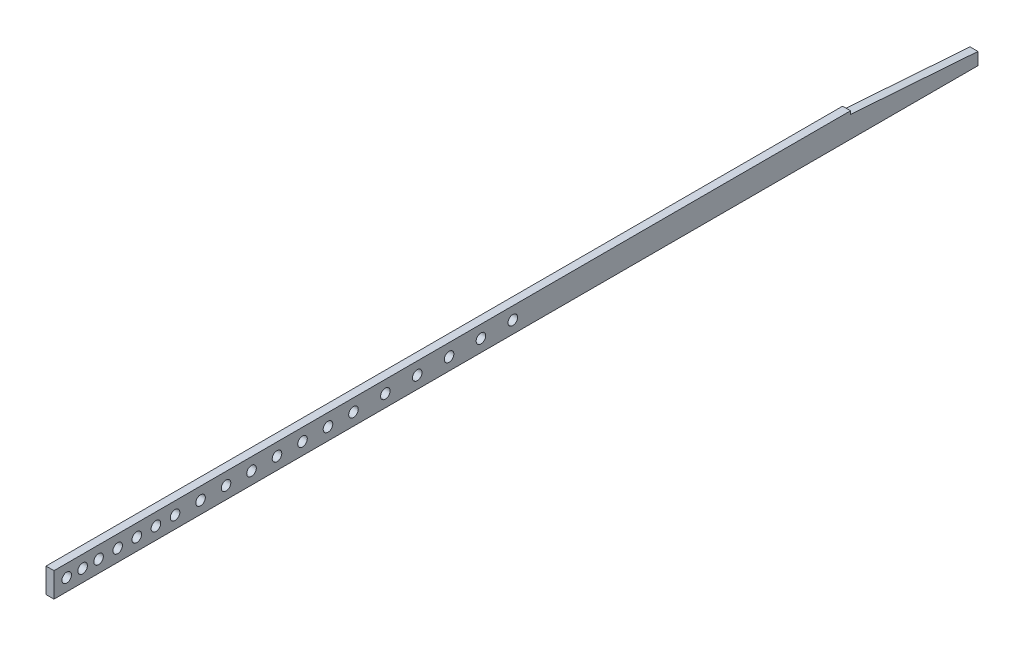
from build123d import *

# Parameters (mm, degrees)
SKIZZE1_W                       = 5
SKIZZE1_H                       = 15.5
GRUNDSTAB_DEPTH                 = 580
SCH_FTUNGINNEN_DEPTH            = 581.228618736
SKIZZE4_R                       = 3
SCHNITT_LINEAR_AUSTRAGEN1_DEPTH = 581.228618736


with BuildPart() as part:
    # Skizze1 → GrundStab (new body)
    with BuildSketch(Plane.XY):
        with Locations((2.5, 7.75)):
            Rectangle(SKIZZE1_W, SKIZZE1_H)
    extrude(amount=GRUNDSTAB_DEPTH)

    # Skizze2 → SchäftungInnen (cut, through all)
    with BuildSketch(Plane.ZY):
        Polygon((0, 15.5), (0, 7.75), (80, 13.5), (80, 15.5), align=None)
    extrude(amount=-SCH_FTUNGINNEN_DEPTH, mode=Mode.SUBTRACT)

    # Skizze4 → Schnitt-Linear austragen1 (cut, through all)
    with BuildSketch(Plane.ZY):
        with Locations((572, 7.75)):
            Circle(SKIZZE4_R)
        with Locations((562, 7.75)):
            Circle(SKIZZE4_R)
        with Locations((552, 7.75)):
            Circle(SKIZZE4_R)
        with Locations((540, 7.75)):
            Circle(SKIZZE4_R)
        with Locations((528, 7.75)):
            Circle(SKIZZE4_R)
        with Locations((516, 7.75)):
            Circle(SKIZZE4_R)
        with Locations((504, 7.75)):
            Circle(SKIZZE4_R)
        with Locations((488, 7.75)):
            Circle(SKIZZE4_R)
        with Locations((472, 7.75)):
            Circle(SKIZZE4_R)
        with Locations((456, 7.75)):
            Circle(SKIZZE4_R)
        with Locations((440, 7.75)):
            Circle(SKIZZE4_R)
        with Locations((424, 7.75)):
            Circle(SKIZZE4_R)
        with Locations((408, 7.75)):
            Circle(SKIZZE4_R)
        with Locations((392, 7.75)):
            Circle(SKIZZE4_R)
        with Locations((372, 7.75)):
            Circle(SKIZZE4_R)
        with Locations((352, 7.75)):
            Circle(SKIZZE4_R)
        with Locations((332, 7.75)):
            Circle(SKIZZE4_R)
        with Locations((312, 7.75)):
            Circle(SKIZZE4_R)
        with Locations((292, 7.75)):
            Circle(SKIZZE4_R)
    extrude(amount=-SCHNITT_LINEAR_AUSTRAGEN1_DEPTH, mode=Mode.SUBTRACT)


solid = part.part
